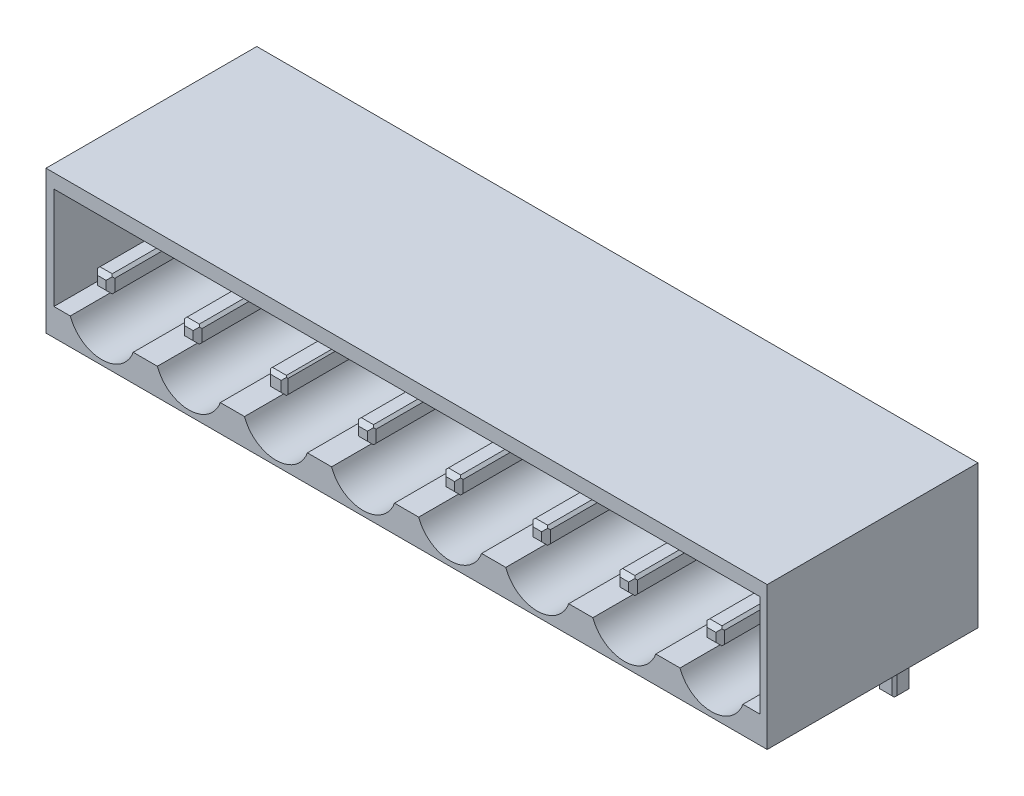
from build123d import *

# Parameters (mm, degrees)
SKETCH_1_W          = 41.4
SKETCH_1_H          = 8.2
EXTRUDE_1_DEPTH     = 12.1
SKETCH_4_R          = 1.25
CUT_EXTRUDE_3_DEPTH = 8
CUT_EXTRUDE_4_DEPTH = 7.8
SKETCH_7_W          = 1
SKETCH_7_H          = 1
EXTRUDE_2_DEPTH     = 8
CHAMFER_1_SIZE      = 0.15
CHAMFER_2_SIZE      = 0.25
SKETCH_8_W          = 1
SKETCH_8_H          = 1
EXTRUDE_3_DEPTH     = 4
CHAMFER_3_SIZE      = 0.15
CHAMFER_4_SIZE      = 0.25
CHAMFER_6_SIZE      = 0.1
CHAMFER_7_SIZE      = 0.2
CHAMFER_8_SIZE      = 0.1
CHAMFER_9_SIZE      = 0.2


with BuildPart() as part:
    # Эскиз1 → Бобышка-Вытянуть1 (new body)
    with BuildSketch(Plane.XY):
        Rectangle(SKETCH_1_W, SKETCH_1_H)
    extrude(amount=EXTRUDE_1_DEPTH)

    # Эскиз4 → Вырез-Вытянуть3 (cut)
    with BuildSketch(Plane.XY.offset(12.1)):
        with Locations((-17.5, 0)):
            Circle(SKETCH_4_R)
        with Locations((-12.5, 0)):
            Circle(SKETCH_4_R)
        with Locations((-7.5, 0)):
            Circle(SKETCH_4_R)
        with Locations((-2.5, 0)):
            Circle(SKETCH_4_R)
        with Locations((2.5, 0)):
            Circle(SKETCH_4_R)
        with Locations((7.5, 0)):
            Circle(SKETCH_4_R)
        with Locations((12.5, 0)):
            Circle(SKETCH_4_R)
        with Locations((17.5, 0)):
            Circle(SKETCH_4_R)
    extrude(amount=-CUT_EXTRUDE_3_DEPTH, mode=Mode.SUBTRACT)

    # Эскиз5 → Вырез-Вытянуть4 (cut)
    with BuildSketch(Plane.XY.offset(12.1)):
        with BuildLine():
            Line((-20.245621634, 0), (-20.245621634, 3.292901982))
            Line((-20.245621634, 3.292901982), (-9.721490456, 3.292901982))
            Line((-9.721490456, 3.292901982), (-4.721490456, 3.292901982))
            Line((-4.721490456, 3.292901982), (0.278509544, 3.292901982))
            Line((0.278509544, 3.292901982), (10.278509544, 3.292901982))
            Line((10.278509544, 3.292901982), (20.278509544, 3.292901982))
            Line((20.278509544, 3.292901982), (20.278509544, -2.548957219))
            Line((20.278509544, -2.548957219), (19.30582632, -2.548957219))
            ThreePointArc((19.30582632, -2.548957219), (17.5, -3.818893996), (15.69417368, -2.548957219))
            Line((15.69417368, -2.548957219), (14.30582632, -2.548957219))
            ThreePointArc((14.30582632, -2.548957219), (12.5, -3.818893996), (10.69417368, -2.548957219))
            Line((10.69417368, -2.548957219), (9.30582632, -2.548957219))
            ThreePointArc((9.30582632, -2.548957219), (7.5, -3.818893996), (5.69417368, -2.548957219))
            Line((5.69417368, -2.548957219), (4.30582632, -2.548957219))
            ThreePointArc((4.30582632, -2.548957219), (2.5, -3.818893996), (0.69417368, -2.548957219))
            Line((0.69417368, -2.548957219), (-0.69417368, -2.548957219))
            ThreePointArc((-0.69417368, -2.548957219), (-2.5, -3.818893996), (-4.30582632, -2.548957219))
            Line((-4.30582632, -2.548957219), (-5.69417368, -2.548957219))
            ThreePointArc((-5.69417368, -2.548957219), (-7.5, -3.818893996), (-9.30582632, -2.548957219))
            Line((-9.30582632, -2.548957219), (-10.69417368, -2.548957219))
            ThreePointArc((-10.69417368, -2.548957219), (-12.5, -3.818893996), (-14.30582632, -2.548957219))
            Line((-14.30582632, -2.548957219), (-15.69417368, -2.548957219))
            ThreePointArc((-15.69417368, -2.548957219), (-17.5, -3.818893996), (-19.30582632, -2.548957219))
            Line((-19.30582632, -2.548957219), (-20.245621634, -2.548957219))
            Line((-20.245621634, -2.548957219), (-20.245621634, 0))
        make_face()
    extrude(amount=-CUT_EXTRUDE_4_DEPTH, mode=Mode.SUBTRACT)

    # Эскиз7 → Бобышка-Вытянуть2 (add)
    with BuildSketch(Plane.XY.offset(4.1)):
        with Locations((-12.5, 0)):
            Rectangle(SKETCH_7_W, SKETCH_7_H)
        with Locations((-17.5, 0)):
            Rectangle(SKETCH_7_W, SKETCH_7_H)
        with Locations((-7.5, 0)):
            Rectangle(SKETCH_7_W, SKETCH_7_H)
        with Locations((-2.5, 0)):
            Rectangle(SKETCH_7_W, SKETCH_7_H)
        with Locations((2.5, 0)):
            Rectangle(SKETCH_7_W, SKETCH_7_H)
        with Locations((7.5, 0)):
            Rectangle(SKETCH_7_W, SKETCH_7_H)
        with Locations((12.5, 0)):
            Rectangle(SKETCH_7_W, SKETCH_7_H)
        with Locations((17.5, 0)):
            Rectangle(SKETCH_7_W, SKETCH_7_H)
    extrude(amount=EXTRUDE_2_DEPTH)

    # Фаска1
    chamfer_1_edges = [part.edges().sort_by_distance(p)[0] for p in [
        (-17, -0.5, 8.1),
        (-17, 0.5, 8.1),
        (-18, 0.5, 8.1),
        (-18, -0.5, 8.1),
        (-12, -0.5, 8.1),
        (-12, 0.5, 8.1),
        (-13, 0.5, 8.1),
        (-13, -0.5, 8.1),
        (3, -0.5, 8.1),
        (3, 0.5, 8.1),
        (2, 0.5, 8.1),
        (2, -0.5, 8.1),
        (8, -0.5, 8.1),
        (8, 0.5, 8.1),
        (7, 0.5, 8.1),
        (7, -0.5, 8.1),
        (13, -0.5, 8.1),
        (13, 0.5, 8.1),
        (12, 0.5, 8.1),
        (12, -0.5, 8.1),
        (18, -0.5, 8.1),
        (18, 0.5, 8.1),
        (17, 0.5, 8.1),
        (17, -0.5, 8.1),
    ]]
    chamfer(chamfer_1_edges, length=CHAMFER_1_SIZE)

    # Фаска2
    # the kernel refuses this chamfer: 0.25 mm, written as the material it takes off along each edge
    with BuildSketch(Plane(origin=(-13, -0.992920747, 12.1), x_dir=(-0.027495876610589005, 0, -0.9996219169112968), z_dir=(0, 1, 0)), Plane(origin=(-13.492920747, 0.5, 12.1), x_dir=(0, 0.027495876610586414, -0.9996219169112968), z_dir=(1, 0, 0)), Plane(origin=(-12, 0.992920747, 12.1), x_dir=(0.027495876610589005, 0, -0.9996219169112968), z_dir=(0, -1, 0)), Plane(origin=(-11.507079253, -0.5, 12.1), x_dir=(0, -0.027495876610586414, -0.9996219169112968), z_dir=(-1, 0, 0)), Plane(origin=(-17, 0.992920747, 12.1), x_dir=(0.027495876610582105, 0, -0.999621916911297), z_dir=(0, -1, 0)), Plane(origin=(-16.507079253, -0.5, 12.1), x_dir=(0, -0.027495876610586414, -0.9996219169112968), z_dir=(-1, 0, 0)), Plane(origin=(-18, -0.992920747, 12.1), x_dir=(-0.027495876610582105, 0, -0.999621916911297), z_dir=(0, 1, 0)), Plane(origin=(-18.492920747, 0.5, 12.1), x_dir=(0, 0.027495876610586414, -0.9996219169112968), z_dir=(1, 0, 0)), Plane(origin=(8, 0.992920747, 12.1), x_dir=(0.027495876610589005, 0, -0.9996219169112968), z_dir=(0, -1, 0)), Plane(origin=(8.492920747, -0.5, 12.1), x_dir=(0, -0.027495876610586414, -0.9996219169112968), z_dir=(-1, 0, 0)), Plane(origin=(6.507079253, 0.5, 12.1), x_dir=(0, 0.027495876610586414, -0.9996219169112968), z_dir=(1, 0, 0)), Plane(origin=(7, -0.992920747, 12.1), x_dir=(-0.02749587661058555, 0, -0.9996219169112968), z_dir=(0, 1, 0)), Plane(origin=(3, 0.992920747, 12.1), x_dir=(0.02749587661058555, 0, -0.9996219169112968), z_dir=(0, -1, 0)), Plane(origin=(3.492920747, -0.5, 12.1), x_dir=(0, -0.027495876610586414, -0.9996219169112968), z_dir=(-1, 0, 0)), Plane(origin=(2, -0.992920747, 12.1), x_dir=(-0.027495876610586414, 0, -0.9996219169112968), z_dir=(0, 1, 0)), Plane(origin=(1.507079253, 0.5, 12.1), x_dir=(0, 0.027495876610586414, -0.9996219169112968), z_dir=(1, 0, 0)), Plane(origin=(18, 0.992920747, 12.1), x_dir=(0.027495876610582105, 0, -0.999621916911297), z_dir=(0, -1, 0)), Plane(origin=(18.492920747, -0.5, 12.1), x_dir=(0, -0.027495876610586414, -0.9996219169112968), z_dir=(-1, 0, 0)), Plane(origin=(17, -0.992920747, 12.1), x_dir=(-0.027495876610582105, 0, -0.999621916911297), z_dir=(0, 1, 0)), Plane(origin=(16.507079253, 0.5, 12.1), x_dir=(0, 0.027495876610586414, -0.9996219169112968), z_dir=(1, 0, 0)), Plane(origin=(13, 0.992920747, 12.1), x_dir=(0.027495876610589005, 0, -0.9996219169112968), z_dir=(0, -1, 0)), Plane(origin=(13.492920747, -0.5, 12.1), x_dir=(0, -0.027495876610586414, -0.9996219169112968), z_dir=(-1, 0, 0)), Plane(origin=(12, -0.992920747, 12.1), x_dir=(-0.027495876610589005, 0, -0.9996219169112968), z_dir=(0, 1, 0)), Plane(origin=(11.507079253, 0.5, 12.1), x_dir=(0, 0.027495876610586414, -0.9996219169112968), z_dir=(1, 0, 0))) as chamfer_2_piece_1:
        Polygon((CHAMFER_2_SIZE * 0.999621916911, -CHAMFER_2_SIZE * 0.0274958766106), (-CHAMFER_2_SIZE * 0.0274958766106, -CHAMFER_2_SIZE * 0.999621916911), (0, 0), align=None)
    extrude(amount=1.985841494, mode=Mode.SUBTRACT)

    # Эскиз8 → Бобышка-Вытянуть3 (add)
    with BuildSketch(Plane(origin=(0, -4.1, 0), x_dir=(-1, 0, 0), z_dir=(0, -1, 0))):
        with Locations((12.5, -1.6)):
            Rectangle(SKETCH_8_W, SKETCH_8_H)
        with Locations((17.5, -1.6)):
            Rectangle(SKETCH_8_W, SKETCH_8_H)
        with Locations((7.5, -1.6)):
            Rectangle(SKETCH_8_W, SKETCH_8_H)
        with Locations((2.5, -1.6)):
            Rectangle(SKETCH_8_W, SKETCH_8_H)
        with Locations((-2.5, -1.6)):
            Rectangle(SKETCH_8_W, SKETCH_8_H)
        with Locations((-7.5, -1.6)):
            Rectangle(SKETCH_8_W, SKETCH_8_H)
        with Locations((-12.5, -1.6)):
            Rectangle(SKETCH_8_W, SKETCH_8_H)
        with Locations((-17.5, -1.6)):
            Rectangle(SKETCH_8_W, SKETCH_8_H)
    extrude(amount=EXTRUDE_3_DEPTH)

    # Фаска3
    chamfer_3_edges = [part.edges().sort_by_distance(p)[0] for p in [
        (-2, -0.5, 8.1),
        (-2, 0.5, 8.1),
        (-3, 0.5, 8.1),
        (-3, -0.5, 8.1),
        (-17, -6.1, 1.1),
        (-17, -6.1, 2.1),
        (-18, -6.1, 2.1),
        (-18, -6.1, 1.1),
        (-12, -6.1, 1.1),
        (-12, -6.1, 2.1),
        (-13, -6.1, 2.1),
        (-13, -6.1, 1.1),
        (-2, -6.1, 1.1),
        (-2, -6.1, 2.1),
        (-3, -6.1, 2.1),
        (-3, -6.1, 1.1),
        (3, -6.1, 1.1),
        (3, -6.1, 2.1),
        (2, -6.1, 2.1),
        (2, -6.1, 1.1),
        (8, -6.1, 1.1),
        (8, -6.1, 2.1),
        (7, -6.1, 2.1),
        (7, -6.1, 1.1),
        (13, -6.1, 1.1),
        (13, -6.1, 2.1),
        (12, -6.1, 2.1),
        (12, -6.1, 1.1),
        (18, -6.1, 1.1),
        (18, -6.1, 2.1),
        (17, -6.1, 2.1),
        (17, -6.1, 1.1),
    ]]
    chamfer(chamfer_3_edges, length=CHAMFER_3_SIZE)

    # Фаска4
    # the kernel refuses this chamfer: 0.25 mm, written as the material it takes off along each edge
    with BuildSketch(Plane(origin=(-12, -8.1, 2.592920747), x_dir=(0.0274958766105891, 0.9996219169112968, 0), z_dir=(0, 0, -1)), Plane(origin=(-13, -8.1, 0.607079253), x_dir=(-0.0274958766105891, 0.9996219169112968, 0), z_dir=(0, 0, 1)), Plane(origin=(-13.492920747, -8.1, 2.1), x_dir=(0, 0.9996219169112968, 0.027495876610585647), z_dir=(1, 0, 0)), Plane(origin=(-11.507079253, -8.1, 1.1), x_dir=(0, 0.9996219169112968, -0.02749587661058651), z_dir=(-1, 0, 0)), Plane(origin=(-18, -8.1, 0.607079253), x_dir=(-0.0274958766105822, 0.999621916911297, 0), z_dir=(0, 0, 1)), Plane(origin=(-18.492920747, -8.1, 2.1), x_dir=(0, 0.9996219169112968, 0.027495876610585647), z_dir=(1, 0, 0)), Plane(origin=(-17, -8.1, 2.592920747), x_dir=(0.0274958766105822, 0.999621916911297, 0), z_dir=(0, 0, -1)), Plane(origin=(-16.507079253, -8.1, 1.1), x_dir=(0, 0.9996219169112968, -0.02749587661058651), z_dir=(-1, 0, 0)), Plane(origin=(-1.507079253, -8.1, 1.1), x_dir=(0, 0.9996219169112968, -0.02749587661058651), z_dir=(-1, 0, 0)), Plane(origin=(-3, -8.1, 0.607079253), x_dir=(-0.027495876610585647, 0.9996219169112968, 0), z_dir=(0, 0, 1)), Plane(origin=(-3.492920747, -8.1, 2.1), x_dir=(0, 0.9996219169112968, 0.027495876610585647), z_dir=(1, 0, 0)), Plane(origin=(-2, -8.1, 2.592920747), x_dir=(0.02749587661058651, 0.9996219169112968, 0), z_dir=(0, 0, -1)), Plane(origin=(-1.507079253, -0.5, 12.1), x_dir=(0, -0.027495876610586414, -0.9996219169112968), z_dir=(-1, 0, 0)), Plane(origin=(-3, -0.992920747, 12.1), x_dir=(-0.02749587661058555, 0, -0.9996219169112968), z_dir=(0, 1, 0)), Plane(origin=(-2, 0.992920747, 12.1), x_dir=(0.027495876610586414, 0, -0.9996219169112968), z_dir=(0, -1, 0)), Plane(origin=(-3.492920747, 0.5, 12.1), x_dir=(0, 0.027495876610586414, -0.9996219169112968), z_dir=(1, 0, 0)), Plane(origin=(7, -8.1, 0.607079253), x_dir=(-0.027495876610585647, 0.9996219169112968, 0), z_dir=(0, 0, 1)), Plane(origin=(8.492920747, -8.1, 1.1), x_dir=(0, 0.9996219169112968, -0.02749587661058651), z_dir=(-1, 0, 0)), Plane(origin=(8, -8.1, 2.592920747), x_dir=(0.0274958766105891, 0.9996219169112968, 0), z_dir=(0, 0, -1)), Plane(origin=(6.507079253, -8.1, 2.1), x_dir=(0, 0.9996219169112968, 0.027495876610585647), z_dir=(1, 0, 0)), Plane(origin=(3, -8.1, 2.592920747), x_dir=(0.027495876610585647, 0.9996219169112968, 0), z_dir=(0, 0, -1)), Plane(origin=(3.492920747, -8.1, 1.1), x_dir=(0, 0.9996219169112968, -0.02749587661058651), z_dir=(-1, 0, 0)), Plane(origin=(2, -8.1, 0.607079253), x_dir=(-0.02749587661058651, 0.9996219169112968, 0), z_dir=(0, 0, 1)), Plane(origin=(1.507079253, -8.1, 2.1), x_dir=(0, 0.9996219169112968, 0.027495876610585647), z_dir=(1, 0, 0)), Plane(origin=(18, -8.1, 2.592920747), x_dir=(0.0274958766105822, 0.999621916911297, 0), z_dir=(0, 0, -1)), Plane(origin=(18.492920747, -8.1, 1.1), x_dir=(0, 0.9996219169112968, -0.02749587661058651), z_dir=(-1, 0, 0)), Plane(origin=(17, -8.1, 0.607079253), x_dir=(-0.0274958766105822, 0.999621916911297, 0), z_dir=(0, 0, 1)), Plane(origin=(16.507079253, -8.1, 2.1), x_dir=(0, 0.9996219169112968, 0.027495876610585647), z_dir=(1, 0, 0)), Plane(origin=(13, -8.1, 2.592920747), x_dir=(0.0274958766105891, 0.9996219169112968, 0), z_dir=(0, 0, -1)), Plane(origin=(13.492920747, -8.1, 1.1), x_dir=(0, 0.9996219169112968, -0.02749587661058651), z_dir=(-1, 0, 0)), Plane(origin=(12, -8.1, 0.607079253), x_dir=(-0.0274958766105891, 0.9996219169112968, 0), z_dir=(0, 0, 1)), Plane(origin=(11.507079253, -8.1, 2.1), x_dir=(0, 0.9996219169112968, 0.027495876610585647), z_dir=(1, 0, 0))) as chamfer_4_piece_1:
        Polygon((CHAMFER_4_SIZE * 0.999621916911, -CHAMFER_4_SIZE * 0.0274958766106), (-CHAMFER_4_SIZE * 0.0274958766106, -CHAMFER_4_SIZE * 0.999621916911), (0, 0), align=None)
    extrude(amount=1.985841494, mode=Mode.SUBTRACT)

    # Фаска6
    chamfer_6_edges = [part.edges().sort_by_distance(p)[0] for p in [
        (-7, -0.5, 8.1),
        (-7, 0.5, 8.1),
        (-8, 0.5, 8.1),
        (-8, -0.5, 8.1),
    ]]
    chamfer(chamfer_6_edges, length=CHAMFER_6_SIZE)

    # Фаска7
    # the kernel refuses this chamfer: 0.2 mm, written as the material it takes off along each edge
    with BuildSketch(Plane(origin=(-7, 0.914336598, 12.1), x_dir=(0.02749587661058742, 0, -0.9996219169112966), z_dir=(0, -1, 0)), Plane(origin=(-6.585663402, -0.5, 12.1), x_dir=(0, -0.02749587661058634, -0.9996219169112966), z_dir=(-1, 0, 0)), Plane(origin=(-8, -0.914336598, 12.1), x_dir=(-0.02749587661058742, 0, -0.9996219169112966), z_dir=(0, 1, 0)), Plane(origin=(-8.414336598, 0.5, 12.1), x_dir=(0, 0.02749587661058634, -0.9996219169112966), z_dir=(1, 0, 0))) as chamfer_7_piece_1:
        Polygon((CHAMFER_7_SIZE * 0.999621916911, -CHAMFER_7_SIZE * 0.0274958766106), (-CHAMFER_7_SIZE * 0.0274958766106, -CHAMFER_7_SIZE * 0.999621916911), (0, 0), align=None)
    extrude(amount=1.828673195, mode=Mode.SUBTRACT)

    # Фаска8
    chamfer_8_edges = [part.edges().sort_by_distance(p)[0] for p in [
        (-7, -6.1, 1.1),
        (-7, -6.1, 2.1),
        (-8, -6.1, 2.1),
        (-8, -6.1, 1.1),
    ]]
    chamfer(chamfer_8_edges, length=CHAMFER_8_SIZE)

    # Фаска9
    # the kernel refuses this chamfer: 0.2 mm, written as the material it takes off along each edge
    with BuildSketch(Plane(origin=(-7, -8.1, 2.514336598), x_dir=(0.027495876610587302, 0.9996219169112966, 0), z_dir=(0, 0, -1)), Plane(origin=(-6.585663402, -8.1, 1.1), x_dir=(0, 0.9996219169112968, -0.027495876610586226), z_dir=(-1, 0, 0)), Plane(origin=(-8, -8.1, 0.685663402), x_dir=(-0.027495876610587302, 0.9996219169112966, 0), z_dir=(0, 0, 1)), Plane(origin=(-8.414336598, -8.1, 2.1), x_dir=(0, 0.9996219169112966, 0.027495876610587302), z_dir=(1, 0, 0))) as chamfer_9_piece_1:
        Polygon((CHAMFER_9_SIZE * 0.999621916911, -CHAMFER_9_SIZE * 0.0274958766106), (-CHAMFER_9_SIZE * 0.0274958766106, -CHAMFER_9_SIZE * 0.999621916911), (0, 0), align=None)
    extrude(amount=1.828673195, mode=Mode.SUBTRACT)


solid = part.part
